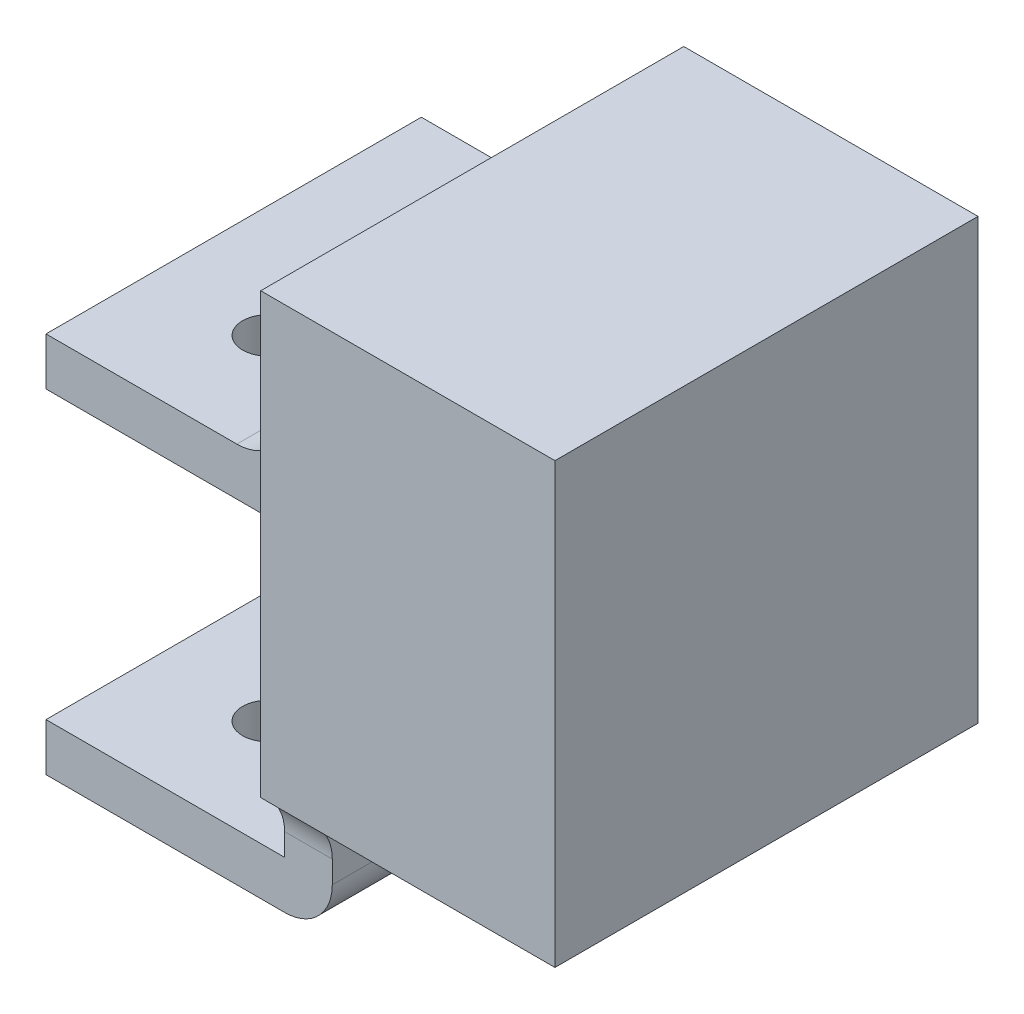
from build123d import *

# Parameters (mm, degrees)
SKETCH1_W                = 26.6
SKETCH1_H                = 27.6
SKETCH1_W_2              = 23.6
SKETCH1_H_2              = 24.6
BOSS_EXTRUDE1_DEPTH      = 12.5
SKETCH2_W                = 26.6
SKETCH2_H                = 27.6
BOSS_EXTRUDE2_DEPTH      = 3
SKETCH4_W                = 26.6
SKETCH4_H                = 27.6
BOSS_EXTRUDE3_DEPTH      = 3
SKETCH6_W                = 12.5
SKETCH6_H                = 20.6
CUT_EXTRUDE1_DEPTH       = 3
BOSS_EXTRUDE4_DEPTH      = 7
BOSS_EXTRUDE4_DEPTH_BACK = 17
SKETCH7_W                = 12.54
SKETCH7_H                = 14.392021094
SKETCH8_R                = 1.6
CUT_EXTRUDE2_DEPTH       = 41.17835238
SKETCH10_W               = 9.54
SKETCH10_H               = 18
CUT_EXTRUDE3_DEPTH       = 34.198989028
SKETCH14_W               = 12.5
SKETCH14_H               = 23.6
CUT_EXTRUDE5_DEPTH       = 3
SKETCH24_W               = 3
SKETCH24_H               = 5.880857343
BOSS_EXTRUDE7_DEPTH      = 7
SKETCH25_W               = 3
SKETCH25_H               = 6.327121563
BOSS_EXTRUDE8_DEPTH      = 7
SKETCH27_W               = 26.6
SKETCH27_H               = 3
BOSS_EXTRUDE9_DEPTH      = 20
SKETCH32_W               = 26.6
SKETCH32_H               = 3
BOSS_EXTRUDE10_DEPTH     = 20
FILLET1_R                = 3
SKETCH35_W               = 20
SKETCH35_H               = 24
CUT_EXTRUDE9_DEPTH       = 1.5
SKETCH36_W               = 3
SKETCH36_H               = 7
CUT_EXTRUDE10_DEPTH      = 1.5
SKETCH37_W               = 20
SKETCH37_H               = 24
CUT_EXTRUDE11_DEPTH      = 1.5
SKETCH38_W               = 3
SKETCH38_H               = 7
CUT_EXTRUDE12_DEPTH      = 1.5
FILLET3_R                = 3
FILLET4_R                = 3
FILLET5_R                = 3
SKETCH39_W               = 5
SKETCH39_H               = 23.6
CUT_EXTRUDE13_DEPTH      = 24
SKETCH41_R               = 1.6
CUT_EXTRUDE14_DEPTH      = 24
SKETCH42_W               = 5.5
SKETCH42_H               = 18.6
CUT_EXTRUDE15_DEPTH      = 38.237749663


with BuildPart() as part:
    # Sketch1 → Boss-Extrude1 (new body)
    with BuildSketch(Plane(origin=(0, 0, 0), x_dir=(0, 0, -1), z_dir=(1, 0, 0))):
        Rectangle(SKETCH1_W, SKETCH1_H)
        Rectangle(SKETCH1_W_2, SKETCH1_H_2, mode=Mode.SUBTRACT)
    extrude(amount=BOSS_EXTRUDE1_DEPTH)

    # Sketch2 → Boss-Extrude2 (add)
    with BuildSketch(Plane.ZY):
        Rectangle(SKETCH2_W, SKETCH2_H)
    extrude(amount=BOSS_EXTRUDE2_DEPTH)

    # Sketch4 → Boss-Extrude3 (add)
    with BuildSketch(Plane(origin=(12.5, 0, 0), x_dir=(0, 0, -1), z_dir=(1, 0, 0))):
        Rectangle(SKETCH4_W, SKETCH4_H)
    extrude(amount=BOSS_EXTRUDE3_DEPTH)

    # Sketch6 → Cut-Extrude1 (cut)
    with BuildSketch(Plane(origin=(0, -13.8, 0), x_dir=(-1, 0, 0), z_dir=(0, -1, 0))):
        with Locations((-6.25, 0)):
            Rectangle(SKETCH6_W, SKETCH6_H)
    extrude(amount=-CUT_EXTRUDE1_DEPTH, mode=Mode.SUBTRACT)

    # Sketch7 → Boss-Extrude4 (add, two sides: drawn at the far end of the back side and taken through both)
    with BuildSketch(Plane(origin=(0, -13.8, 0), x_dir=(-1, 0, 0), z_dir=(0, -1, 0)).offset(-BOSS_EXTRUDE4_DEPTH_BACK)):
        with Locations((6.27, -0.22313211)):
            Rectangle(SKETCH7_W, SKETCH7_H)
    extrude(amount=BOSS_EXTRUDE4_DEPTH + BOSS_EXTRUDE4_DEPTH_BACK)

    # Sketch8 → Cut-Extrude2 (cut, through all)
    with BuildSketch(Plane(origin=(0, -20.8, 0), x_dir=(-1, 0, 0), z_dir=(0, -1, 0))):
        with Locations(Location((9.94, -4.900507757, 0), (0, 0, 90))):
            Circle(SKETCH8_R)
        with Locations(Location((9.94, 4.836704631, 0), (0, 0, 90))):
            Circle(SKETCH8_R)
    extrude(amount=-CUT_EXTRUDE2_DEPTH, mode=Mode.SUBTRACT)

    # Sketch10 → Cut-Extrude3 (cut, through all)
    with BuildSketch(Plane.XY.offset(7.419142657)):
        with Locations((-7.77, -8.8)):
            Rectangle(SKETCH10_W, SKETCH10_H)
    extrude(amount=-CUT_EXTRUDE3_DEPTH, mode=Mode.SUBTRACT)

    # Sketch14 → Cut-Extrude5 (cut)
    with BuildSketch(Plane(origin=(0, -13.8, 0), x_dir=(-1, 0, 0), z_dir=(0, -1, 0))):
        with Locations((-6.25, 0)):
            Rectangle(SKETCH14_W, SKETCH14_H)
    extrude(amount=-CUT_EXTRUDE5_DEPTH, mode=Mode.SUBTRACT)

    # Sketch24 → Boss-Extrude7 (add)
    with BuildSketch(Plane(origin=(0, -13.8, 0), x_dir=(-1, 0, 0), z_dir=(0, -1, 0))):
        with Locations((1.5, -10.359571328)):
            Rectangle(SKETCH24_W, SKETCH24_H)
    extrude(amount=BOSS_EXTRUDE7_DEPTH)

    # Sketch25 → Boss-Extrude8 (add)
    with BuildSketch(Plane(origin=(0, -13.8, 0), x_dir=(-1, 0, 0), z_dir=(0, -1, 0))):
        with Locations((1.5, 10.136439219)):
            Rectangle(SKETCH25_W, SKETCH25_H)
    extrude(amount=BOSS_EXTRUDE8_DEPTH)

    # Sketch27 → Boss-Extrude9 (add)
    with BuildSketch(Plane.ZY.offset(3)):
        with Locations((0, -19.3)):
            Rectangle(SKETCH27_W, SKETCH27_H)
    extrude(amount=BOSS_EXTRUDE9_DEPTH)

    # Sketch32 → Boss-Extrude10 (add)
    with BuildSketch(Plane.ZY.offset(3)):
        with Locations((0, 1.7)):
            Rectangle(SKETCH32_W, SKETCH32_H)
    extrude(amount=BOSS_EXTRUDE10_DEPTH)

    # Fillet1
    fillet1_edges = [part.edges().sort_by_distance(p)[0] for p in [
        (0, -20.8, 0),
    ]]
    fillet(fillet1_edges, radius=FILLET1_R)

    # Sketch35 → Cut-Extrude9 (cut)
    with BuildSketch(Plane.XY.offset(13.3)):
        with Locations((-13, -8.8)):
            Rectangle(SKETCH35_W, SKETCH35_H)
    extrude(amount=-CUT_EXTRUDE9_DEPTH, mode=Mode.SUBTRACT)

    # Sketch36 → Cut-Extrude10 (cut)
    with BuildSketch(Plane.XY.offset(13.3)):
        with Locations((-1.5, -17.3)):
            Rectangle(SKETCH36_W, SKETCH36_H)
    extrude(amount=-CUT_EXTRUDE10_DEPTH, mode=Mode.SUBTRACT)

    # Sketch37 → Cut-Extrude11 (cut)
    with BuildSketch(Plane(origin=(0, 0, -13.3), x_dir=(-1, 0, 0), z_dir=(0, 0, -1))):
        with Locations((13, -8.8)):
            Rectangle(SKETCH37_W, SKETCH37_H)
    extrude(amount=-CUT_EXTRUDE11_DEPTH, mode=Mode.SUBTRACT)

    # Sketch38 → Cut-Extrude12 (cut)
    with BuildSketch(Plane(origin=(0, 0, -13.3), x_dir=(-1, 0, 0), z_dir=(0, 0, -1))):
        with Locations((1.5, -17.3)):
            Rectangle(SKETCH38_W, SKETCH38_H)
    extrude(amount=-CUT_EXTRUDE12_DEPTH, mode=Mode.SUBTRACT)

    # Fillet3
    # the kernel refuses this fillet: 3 mm, written as the material it adds along each edge
    with BuildSketch(Plane(origin=(-3, -13.8, 11.8), x_dir=(0, 0, 1), z_dir=(1, 0, 0))) as fillet3_piece_1:
        with BuildLine():
            CenterArc((3, 2.598076211), FILLET3_R, 180, 60)
            Line((0, 2.598076211), (0, 0))
            Line((0, 0), (1.5, 0))
        make_face()
    extrude(amount=3)

    # Fillet4
    # the kernel refuses this fillet: 3 mm, written as the material it adds along each edge
    with BuildSketch(Plane(origin=(0, -13.8, -11.8), x_dir=(0, 0, -1), z_dir=(-1, 0, 0))) as fillet4_piece_1:
        with BuildLine():
            CenterArc((3, 2.598076211), FILLET4_R, 180, 60)
            Line((0, 2.598076211), (0, 0))
            Line((0, 0), (1.5, 0))
        make_face()
    extrude(amount=3)

    # Fillet5
    fillet5_edges = [part.edges().sort_by_distance(p)[0] for p in [
        (-3, 3.2, 0),
    ]]
    fillet(fillet5_edges, radius=FILLET5_R)

    # Sketch39 → Cut-Extrude13 (cut)
    with BuildSketch(Plane(origin=(0, -20.8, 0), x_dir=(-1, 0, 0), z_dir=(0, -1, 0))):
        with Locations((20.5, 0)):
            Rectangle(SKETCH39_W, SKETCH39_H)
    extrude(amount=-CUT_EXTRUDE13_DEPTH, mode=Mode.SUBTRACT)

    # Sketch41 → Cut-Extrude14 (cut)
    with BuildSketch(Plane(origin=(0, -20.8, 0), x_dir=(-1, 0, 0), z_dir=(0, -1, 0))):
        with Locations(Location((10.94, -4.900507757, 0), (0, 0, 90))):
            Circle(SKETCH41_R)
        with Locations(Location((10.94, 4.836704631, 0), (0, 0, 90))):
            Circle(SKETCH41_R)
    extrude(amount=-CUT_EXTRUDE14_DEPTH, mode=Mode.SUBTRACT)

    # Sketch42 → Cut-Extrude15 (cut, through all)
    with BuildSketch(Plane(origin=(0, 0, 11.8), x_dir=(-1, 0, 0), z_dir=(0, 0, -1))):
        with Locations((-4.75, 1.5)):
            Rectangle(SKETCH42_W, SKETCH42_H)
    extrude(amount=CUT_EXTRUDE15_DEPTH, mode=Mode.SUBTRACT)


solid = part.part
